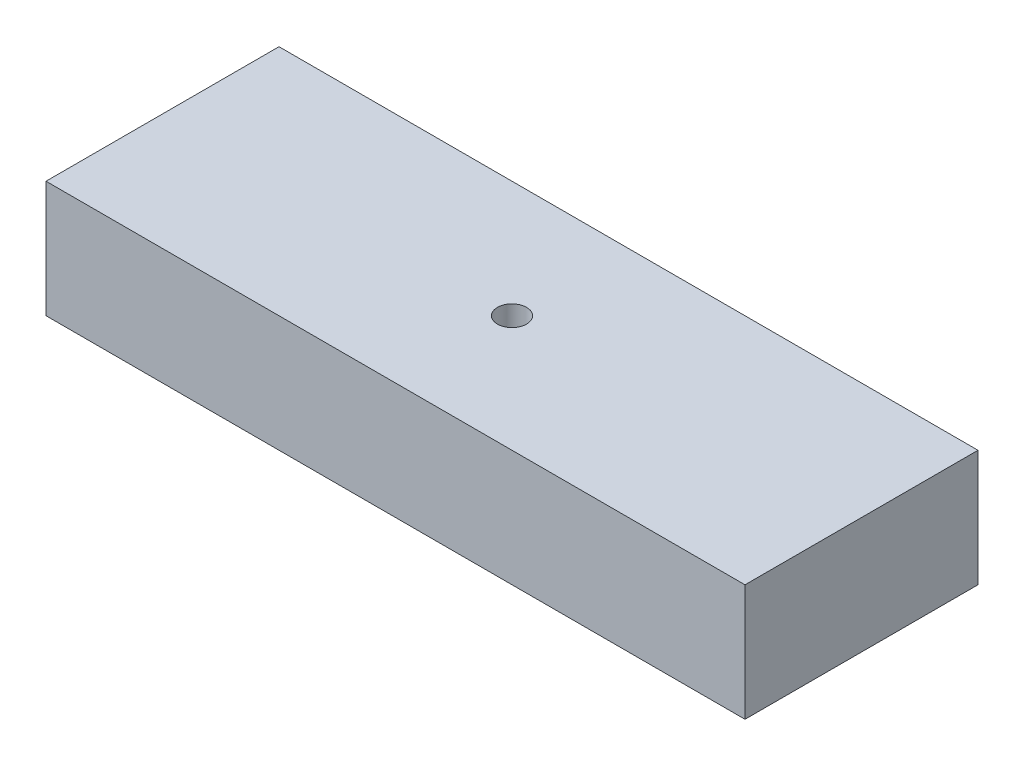
from build123d import *

# Parameters (mm, degrees)
SKETCH1_W                  = 304.8
SKETCH1_H                  = 101.6
BOSS_EXTRUDE1_DEPTH        = 50.8
F_1_2_0_5_DIAMETER_HOLE1_D = 12.7


with BuildPart() as part:
    # Sketch1 → Boss-Extrude1 (new body)
    with BuildSketch(Plane(origin=(0, 0, 0), x_dir=(1, 0, 0), z_dir=(0, 1, 0))):
        Rectangle(SKETCH1_W, SKETCH1_H)
    extrude(amount=BOSS_EXTRUDE1_DEPTH)

    # 1/2 (0.5) Diameter Hole1 (through all)
    with Locations(Plane(origin=(0, 50.8, 0), x_dir=(1, 0, 0), z_dir=(0, 1, 0))):
        with Locations((0, 0)):
            Hole(F_1_2_0_5_DIAMETER_HOLE1_D / 2)


solid = part.part
